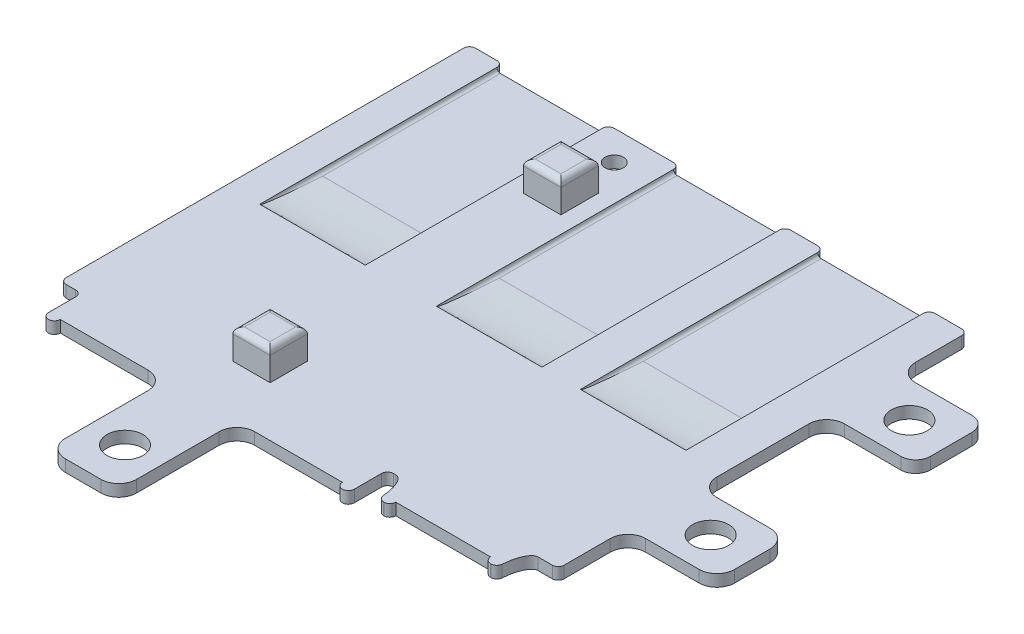
from build123d import *

# Parameters (mm, degrees)
BOSS_EXTRUDE1_DEPTH = 2
SKETCH3_R           = 1.55
CUT_EXTRUDE1_DEPTH  = 2
SKETCH4_W           = 6.3
SKETCH4_H           = 6.3
BOSS_EXTRUDE2_DEPTH = 5
FILLET1_R           = 1
SKETCH5_W           = 17.8
SKETCH5_H           = 40
CUT_EXTRUDE2_DEPTH  = 0.6
FILLET2_SIZE        = 0.6
FILLET2_SIZE_2      = 10
FILLET3_SIZE        = 10
FILLET3_SIZE_2      = 0.6
FILLET4_START       = -41.056486824
FILLET4_DEPTH       = 41.056486824
SKETCH9_W           = 14
SKETCH9_H           = 2
CUT_EXTRUDE3_DEPTH  = 12
SKETCH8_W           = 12
SKETCH8_H           = 19.935125051
SKETCH8_R           = 3.05
SKETCH8_W_2         = 15
SKETCH8_H_2         = 12
SKETCH8_W_3         = 10
BOSS_EXTRUDE3_DEPTH = 2
CUT_EXTRUDE4_DEPTH  = 2
SKETCH11_W          = 2.5
SKETCH11_H          = 12
BOSS_EXTRUDE4_DEPTH = 2
FILLET5_R           = 3
BOSS_EXTRUDE5_DEPTH = 2
CUT_EXTRUDE5_DEPTH  = 0.6
FILLET6_SIZE        = 0.6
FILLET6_SIZE_2      = 10
FILLET7_START       = 81
FILLET7_DEPTH       = 41.256486824


with BuildPart() as part:
    # Sketch2 → Boss-Extrude1 (new body)
    with BuildSketch(Plane(origin=(0, 0, 0), x_dir=(1, 0, 0), z_dir=(0, 1, 0))):
        with BuildLine():
            add(Edge.make_bspline(
                [(-43.133735674, -31.075024803), (-43.441235903, -26.999732955), (-45.1, -27)],
                knots=[0, 0, 0, 0.872967449, 0.872967449, 0.872967449], degree=2, weights=[0.935039048, 0.744313754, 1]))
            Line((-43.133735674, -31.075024803), (-43.134516898, -31.075080485))
            ThreePointArc((-43.134516898, -31.075080485), (-42.817383359, -31.73317136), (-42.137339421, -32))
            Line((-42.137339421, -32), (-42.1, -32))
            ThreePointArc((-42.1, -32), (-41.392893219, -31.707106781), (-41.1, -31))
            Line((-41.1, -31), (-25.1, -31))
            ThreePointArc((-25.1, -31), (-24.807106781, -31.707106781), (-24.1, -32))
            Line((-24.1, -32), (-24.062660579, -32))
            ThreePointArc((-24.062660579, -32), (-23.382616641, -31.73317136), (-23.065483102, -31.075080485))
            Line((-23.065483102, -31.075080485), (-23.066258848, -31.075026704))
            add(Edge.make_bspline(
                [(-21.1, -27), (-22.758763854, -26.999734864), (-23.066258848, -31.075026704)],
                knots=[0, 0, 0, 0.872967652, 0.872967652, 0.872967652], degree=2, weights=[1, 0.744313695, 0.935039136]))
            Line((-21.1, -27), (-20.7, -27))
            ThreePointArc((-20.7, -27), (-19.992893219, -27.292893219), (-19.7, -28))
            Line((-19.7, -28), (-19.7, -32.6))
            ThreePointArc((-19.7, -32.6), (-19.407106781, -33.307106781), (-18.7, -33.6))
            ThreePointArc((-18.7, -33.6), (-17.992893219, -33.307106781), (-17.7, -32.6))
            Line((-17.7, -32.6), (0.1, -32.6))
            ThreePointArc((0.1, -32.6), (0.392893219, -33.307106781), (1.1, -33.6))
            Line((1.1, -33.6), (1.1, -38.6))
            ThreePointArc((1.1, -38.6), (1.685786438, -40.014213562), (3.1, -40.6))
            Line((3.1, -40.6), (9.1, -40.6))
            ThreePointArc((9.1, -40.6), (10.514213562, -40.014213562), (11.1, -38.6))
            Line((11.1, -38.6), (11.1, -33.6))
            ThreePointArc((11.1, -33.6), (11.807106781, -33.307106781), (12.1, -32.6))
            Line((12.1, -32.6), (29.9, -32.6))
            ThreePointArc((29.9, -32.6), (30.192893219, -33.307106781), (30.9, -33.6))
            ThreePointArc((30.9, -33.6), (31.607106781, -33.307106781), (31.9, -32.6))
            Line((31.9, -32.6), (31.9, -28))
            ThreePointArc((31.9, -28), (32.192893219, -27.292893219), (32.9, -27))
            Line((32.9, -27), (34.519316028, -27))
            ThreePointArc((34.519316028, -27), (35.22642281, -26.707106781), (35.519316028, -26))
            Line((35.519316028, -26), (35.519316028, 41.056486824))
            ThreePointArc((35.519316028, 41.056486824), (35.22642281, 41.763593605), (34.519316028, 42.056486824))
            Line((34.519316028, 42.056486824), (30.9, 42.056486824))
            ThreePointArc((30.9, 42.056486824), (30.192893219, 41.763593605), (29.9, 41.056486824))
            Line((29.9, 41.056486824), (12.1, 41.056486824))
            ThreePointArc((12.1, 41.056486824), (11.807106781, 41.763593605), (11.1, 42.056486824))
            Line((11.1, 42.056486824), (1.1, 42.056486824))
            ThreePointArc((1.1, 42.056486824), (0.392893219, 41.763593605), (0.1, 41.056486824))
            Line((0.1, 41.056486824), (-17.7, 41.056486824))
            ThreePointArc((-17.7, 41.056486824), (-17.992893219, 41.763593605), (-18.7, 42.056486824))
            Line((-18.7, 42.056486824), (-21.1, 42.056486824))
            add(Edge.make_bspline(
                [(-23.066264546, 46.131511613), (-22.758764127, 42.056219704), (-21.1, 42.056486824)],
                knots=[0.127032551, 0.127032551, 0.127032551, 1, 1, 1], degree=2, weights=[0.935039048, 0.744313754, 1]))
            Line((-23.066264546, 46.131511613), (-23.065483102, 46.13156731))
            ThreePointArc((-23.065483102, 46.13156731), (-23.382616641, 46.789658184), (-24.062660579, 47.056486824))
            Line((-24.062660579, 47.056486824), (-24.1, 47.056486824))
            ThreePointArc((-24.1, 47.056486824), (-24.807106781, 46.763593605), (-25.1, 46.056486824))
            Line((-25.1, 46.056486824), (-41.1, 46.056486824))
            ThreePointArc((-41.1, 46.056486824), (-41.392893219, 46.763593605), (-42.1, 47.056486824))
            Line((-42.1, 47.056486824), (-42.137339421, 47.056486824))
            ThreePointArc((-42.137339421, 47.056486824), (-42.817383359, 46.789658184), (-43.134516898, 46.13156731))
            Line((-43.134516898, 46.13156731), (-43.133741152, 46.131513528))
            add(Edge.make_bspline(
                [(-45.1, 42.056486824), (-43.441236146, 42.056221689), (-43.133741152, 46.131513528)],
                knots=[0.127032348, 0.127032348, 0.127032348, 1, 1, 1], degree=2, weights=[1, 0.744313695, 0.935039136]))
            Line((-45.1, 42.056486824), (-47.5, 42.056486824))
            ThreePointArc((-47.5, 42.056486824), (-48.207106781, 41.763593605), (-48.5, 41.056486824))
            Line((-48.5, 41.056486824), (-48.5, 27.370991216))
            add(Edge.make_bspline(
                [(-53.5, 25.370991216), (-48.5, 25.370991216), (-48.5, 27.370991216)],
                knots=[0, 0, 0, 1, 1, 1], degree=2, weights=[1, 0.707106781, 1]))
            Line((-53.5, 25.370991216), (-58.5, 25.370991216))
            ThreePointArc((-58.5, 25.370991216), (-59.914213562, 24.785204778), (-60.5, 23.370991216))
            Line((-60.5, 23.370991216), (-60.5, 17.370991216))
            ThreePointArc((-60.5, 17.370991216), (-59.914213562, 15.956777654), (-58.5, 15.370991216))
            Line((-58.5, 15.370991216), (-53.5, 15.370991216))
            add(Edge.make_bspline(
                [(-48.5, 13.370991216), (-48.5, 15.370991216), (-53.5, 15.370991216)],
                knots=[0, 0, 0, 1, 1, 1], degree=2, weights=[1, 0.707106781, 1]))
            Line((-48.5, 13.370991216), (-48.5, 1.685495608))
            add(Edge.make_bspline(
                [(-53.5, -0.314504392), (-48.5, -0.314504392), (-48.5, 1.685495608)],
                knots=[0, 0, 0, 1, 1, 1], degree=2, weights=[1, 0.707106781, 1]))
            Line((-53.5, -0.314504392), (-58.5, -0.314504392))
            ThreePointArc((-58.5, -0.314504392), (-59.914213562, -0.90029083), (-60.5, -2.314504392))
            Line((-60.5, -2.314504392), (-60.5, -8.314504392))
            ThreePointArc((-60.5, -8.314504392), (-59.914213562, -9.728717954), (-58.5, -10.314504392))
            Line((-58.5, -10.314504392), (-53.5, -10.314504392))
            add(Edge.make_bspline(
                [(-48.5, -12.314504392), (-48.5, -10.314504392), (-53.5, -10.314504392)],
                knots=[0, 0, 0, 1, 1, 1], degree=2, weights=[1, 0.707106781, 1]))
            Line((-48.5, -12.314504392), (-48.5, -26))
            ThreePointArc((-48.5, -26), (-48.207106781, -26.707106781), (-47.5, -27))
            Line((-47.5, -27), (-45.1, -27))
        make_face()
    extrude(amount=BOSS_EXTRUDE1_DEPTH)

    # Sketch3 → Cut-Extrude1 (cut)
    with BuildSketch(Plane(origin=(0, 2, 0), x_dir=(1, 0, 0), z_dir=(0, 1, 0))):
        with Locations(Location((6.1, 37.056486824, 0), (0, 0, 90))):
            Circle(SKETCH3_R)
        with Locations(Location((6.1, -37.1, 0), (0, 0, 90))):
            Circle(SKETCH3_R)
        with Locations(Location((-57, -5.314504392, 0), (0, 0, 90))):
            Circle(SKETCH3_R)
        with Locations(Location((-57, 20.370991216, 0), (0, 0, 90))):
            Circle(SKETCH3_R)
    extrude(amount=-CUT_EXTRUDE1_DEPTH, mode=Mode.SUBTRACT)

    # Sketch4 → Boss-Extrude2 (add)
    with BuildSketch(Plane(origin=(0, 2, 0), x_dir=(1, 0, 0), z_dir=(0, 1, 0))):
        with Locations((6.1, -21)):
            Rectangle(SKETCH4_W, SKETCH4_H)
        with Locations((6.1, 28.056486824)):
            Rectangle(SKETCH4_W, SKETCH4_H)
    extrude(amount=BOSS_EXTRUDE2_DEPTH)

    # Fillet1
    fillet1_edges = [part.edges().sort_by_distance(p)[0] for p in [
        (2.95, 7, 21),
        (6.1, 7, 24.15),
        (9.25, 7, 21),
        (6.1, 7, 17.85),
        (2.95, 7, -28.056486824),
        (6.1, 7, -24.906486824),
        (9.25, 7, -28.056486824),
        (6.1, 7, -31.206486824),
    ]]
    fillet(fillet1_edges, radius=FILLET1_R)

    # Sketch5 → Cut-Extrude2 (cut)
    with BuildSketch(Plane(origin=(0, 2, 0), x_dir=(1, 0, 0), z_dir=(0, 1, 0))):
        with Locations((-8.8, 21.056486824)):
            Rectangle(SKETCH5_W, SKETCH5_H)
        with Locations((21, 21.056486824)):
            Rectangle(SKETCH5_W, SKETCH5_H)
    extrude(amount=-CUT_EXTRUDE2_DEPTH, mode=Mode.SUBTRACT)

    # Fillet2
    # a fillet whose section is not a circle: 10, 0.6 mm, written as the material it adds along each edge
    with BuildSketch(Plane(origin=(29.9, 1.4, -1.056486824), x_dir=(0, 1, 0), z_dir=(-1, 0, 0))) as fillet2_piece_1_section:
        with BuildLine():
            Bezier((FILLET2_SIZE, 0), (0, 0), (0, FILLET2_SIZE_2), weights=[1, 0.707106781, 1])
            Line((0, FILLET2_SIZE_2), (0, 0))
            Line((0, 0), (FILLET2_SIZE, 0))
        make_face()
    fillet2_piece_1 = extrude(amount=42.8, mode=Mode.PRIVATE)
    fillet2_piece_1 = split(fillet2_piece_1, bisect_by=Plane(origin=(0.1, 1.4, -1.056486824), z_dir=(1, 0, 0)), keep=Keep.TOP, mode=Mode.PRIVATE)
    add(fillet2_piece_1)

    # Fillet3
    # a fillet whose section is not a circle: 10, 0.6 mm, written as the material it adds along each edge
    with BuildSketch(Plane(origin=(25.1, 1.4, -1.056486824), x_dir=(0, 0, -1), z_dir=(-1, 0, 0))) as fillet3_piece_1:
        with BuildLine():
            Bezier((FILLET3_SIZE, 0), (0, 0), (0, -FILLET3_SIZE_2), weights=[1, 0.707106781, 1])
            Line((0, -FILLET3_SIZE_2), (0, 0))
            Line((0, 0), (FILLET3_SIZE, 0))
        make_face()
    extrude(amount=67.8)

    # Fillet4: read off the stored shape, not the designer's step
    # Fillet4 outline → Fillet4 (add)
    with BuildSketch(Plane.XY.offset(FILLET4_START)):
        with BuildLine():
            Line((0.1, 1.4), (0.1, 2))
            ThreePointArc((0.1, 2), (-0.075735931, 1.575735931), (-0.5, 1.4))
            Line((-0.5, 1.4), (0.1, 1.4))
        make_face()
        with BuildLine():
            Line((-17.7, 1.4), (-17.1, 1.4))
            ThreePointArc((-17.1, 1.4), (-17.524264069, 1.575735931), (-17.7, 2))
            Line((-17.7, 2), (-17.7, 1.4))
        make_face()
        with BuildLine():
            ThreePointArc((29.9, 2), (29.724264069, 1.575735931), (29.3, 1.4))
            Line((29.3, 1.4), (29.9, 1.4))
            Line((29.9, 1.4), (29.9, 2))
        make_face()
        with BuildLine():
            ThreePointArc((12.7, 1.4), (12.275735931, 1.575735931), (12.1, 2))
            Line((12.1, 2), (12.1, 1.4))
            Line((12.1, 1.4), (12.7, 1.4))
        make_face()
    extrude(amount=FILLET4_DEPTH)


with BuildPart() as body_2:
    # Mirror1: mirrored copy
    add(part.part.mirror(Plane(origin=(35.519316028, 2, -41.056486824), x_dir=(0, 0, 1), z_dir=(1, 0, 0))))


with BuildPart() as body_2_2:
    # Mirror2: mirrored copy
    add(body_2.part.mirror(Plane(origin=(61.938632057, 2, 40.6), x_dir=(1, 0, 0), z_dir=(0, 0, 1))))

    # Sketch9 → Cut-Extrude3 (cut)
    with BuildSketch(Plane(origin=(119.538632057, 0, 0), x_dir=(0, 0, -1), z_dir=(1, 0, 0))):
        with Locations((-75.885495608, 1)):
            Rectangle(SKETCH9_W, SKETCH9_H)
        with Locations((-101.570991216, 1)):
            Rectangle(SKETCH9_W, SKETCH9_H)
    extrude(amount=CUT_EXTRUDE3_DEPTH, mode=Mode.SUBTRACT)

    # Sketch8 → Boss-Extrude3 (add)
    # profile 1 of 3: a face of its own
    with BuildSketch(Plane.XZ):
        with Locations((64.938632057, 38.632437475)):
            Rectangle(SKETCH8_W, SKETCH8_H)
        with Locations(Location((64.938632057, 35.714874949, 0), (0, 0, 270))):
            Circle(SKETCH8_R, mode=Mode.SUBTRACT)
    # profile 2 of 3: a face of its own
    with BuildSketch(Plane.XZ):
        with Locations((127.038632057, 71.964122065)):
            Rectangle(SKETCH8_W_2, SKETCH8_H_2)
        with Locations(Location((127.488632057, 71.964122065, 0), (0, 0, 270))):
            Circle(SKETCH8_R, mode=Mode.SUBTRACT)
    # profile 3 of 3: a face of its own
    with BuildSketch(Plane.XZ):
        with Locations((127.038632057, 105.492365238)):
            Rectangle(SKETCH8_W_3, SKETCH8_H_2)
        with Locations(Location((127.488632057, 105.492365238, 0), (0, 0, 270))):
            Circle(SKETCH8_R, mode=Mode.SUBTRACT)
    extrude(amount=-BOSS_EXTRUDE3_DEPTH)


with BuildPart() as boss_extrude3_piece_1:
    # of the separate pieces the step leaves, piece 1, a body of its own (boss_extrude3_pieces)
    add(body_2_2.part.solids().sort_by_distance((45.938632057, 1.4, 92.256486824))[0])

    # Sketch10 → Cut-Extrude4 (cut)
    with BuildSketch(Plane(origin=(0, 2, 0), x_dir=(1, 0, 0), z_dir=(0, 1, 0))):
        with BuildLine():
            Line((113.038632057, -122.256486824), (95.238632057, -122.256486824))
            ThreePointArc((95.238632057, -122.256486824), (94.945738838, -122.963593605), (94.238632057, -123.256486824))
            Line((94.238632057, -123.256486824), (92.138632057, -123.256486824))
            Line((92.138632057, -123.256486824), (92.138632057, -130.132533023))
            Line((92.138632057, -130.132533023), (117.597770552, -130.132533023))
            Line((117.597770552, -130.132533023), (116.138632057, -123.256486824))
            Line((116.138632057, -123.256486824), (114.038632057, -123.256486824))
            ThreePointArc((114.038632057, -123.256486824), (113.331525275, -122.963593605), (113.038632057, -122.256486824))
        make_face()
    extrude(amount=-CUT_EXTRUDE4_DEPTH, mode=Mode.SUBTRACT)



with BuildPart() as boss_extrude3_piece_2:
    # of the separate pieces the step leaves, piece 2, a body of its own (boss_extrude3_pieces)
    add(body_2_2.part.solids().sort_by_distance((122.038632057, 0, 99.492365238))[0])


with BuildPart() as boss_extrude3_piece_1_1:
    add(boss_extrude3_piece_1.part)

    add(boss_extrude3_piece_2.part)  # Boss-Extrude4 merges Boss-Extrude3 piece 2
    # Sketch11 → Boss-Extrude4 (add)
    with BuildSketch(Plane(origin=(0, 2, 0), x_dir=(1, 0, 0), z_dir=(0, 1, 0))):
        with Locations((120.788632057, -105.492365238)):
            Rectangle(SKETCH11_W, SKETCH11_H)
    extrude(amount=-BOSS_EXTRUDE4_DEPTH)

    # Fillet5
    fillet5_edges = [boss_extrude3_piece_1_1.edges().sort_by_distance(p)[0] for p in [
        (70.938632057, 1, 48.6),
        (58.938632057, 1, 48.6),
        (58.938632057, 1, 28.664874949),
        (70.938632057, 1, 28.664874949),
        (119.538632057, 1, 77.964122065),
        (119.538632057, 1, 65.964122065),
        (134.538632057, 1, 65.964122065),
        (134.538632057, 1, 77.964122065),
        (119.538632057, 1, 99.492365238),
        (119.538632057, 1, 111.492365238),
        (132.038632057, 1, 99.492365238),
        (132.038632057, 1, 111.492365238),
    ]]
    fillet(fillet5_edges, radius=FILLET5_R)

    # Sketch12 → Boss-Extrude5 (add)
    with BuildSketch(Plane.XZ):
        with BuildLine():
            Line((129.038632057, 99.492365238), (132.038632057, 99.492365238))
            ThreePointArc((132.038632057, 99.492365238), (133.80639901, 100.224598285), (134.538632057, 101.992365238))
            Line((134.538632057, 101.992365238), (134.538632057, 108.992365238))
            ThreePointArc((134.538632057, 108.992365238), (133.80639901, 110.760132191), (132.038632057, 111.492365238))
            Line((132.038632057, 111.492365238), (129.038632057, 111.492365238))
            Line((129.038632057, 111.492365238), (131.425581151, 105.69585083))
            Line((131.425581151, 105.69585083), (129.038632057, 99.492365238))
        make_face()
    extrude(amount=-BOSS_EXTRUDE5_DEPTH)

    # Sketch13 → Cut-Extrude5 (cut)
    with BuildSketch(Plane(origin=(0, 2, 0), x_dir=(1, 0, 0), z_dir=(0, 1, 0))):
        Polygon((113.038632057, -122.256486824), (113.038632057, -82.256486824), (95.238632057, -82.256486824), (95.238632057, -122.256486824), (95.838632057, -122.256486824), (112.438632057, -122.256486824), align=None)
    extrude(amount=-CUT_EXTRUDE5_DEPTH, mode=Mode.SUBTRACT)

    # Fillet6
    # a fillet whose section is not a circle: 10, 0.6 mm, written as the material it adds along each edge
    with BuildSketch(Plane(origin=(113.038632057, 1.4, 82.256486824), x_dir=(0, 1, 0), z_dir=(-1, 0, 0))) as fillet6_piece_1:
        with BuildLine():
            Bezier((FILLET6_SIZE, 0), (0, 0), (0, -FILLET6_SIZE_2), weights=[1, 0.707106781, 1])
            Line((0, -FILLET6_SIZE_2), (0, 0))
            Line((0, 0), (FILLET6_SIZE, 0))
        make_face()
    extrude(amount=42.8)

    # Fillet7: read off the stored shape, not the designer's step
    # Fillet7 outline → Fillet7 (add)
    with BuildSketch(Plane.XY.offset(FILLET7_START)):
        with BuildLine():
            Line((95.238632057, 1.4), (95.838632057, 1.4))
            ThreePointArc((95.838632057, 1.4), (95.414367988, 1.575735931), (95.238632057, 2))
            Line((95.238632057, 2), (95.238632057, 1.4))
        make_face()
        with BuildLine():
            ThreePointArc((113.038632057, 2), (112.862896126, 1.575735931), (112.438632057, 1.4))
            Line((112.438632057, 1.4), (113.038632057, 1.4))
            Line((113.038632057, 1.4), (113.038632057, 2))
        make_face()
    extrude(amount=FILLET7_DEPTH)


with BuildPart() as body_2_3:
    # Mirror3: mirrored copy
    add(boss_extrude3_piece_1_1.part.mirror(Plane(origin=(58.938632057, 25.268201709, 28.664874949), x_dir=(1, 0, 0), z_dir=(0, 0, -1))))


solid = body_2_3.part
